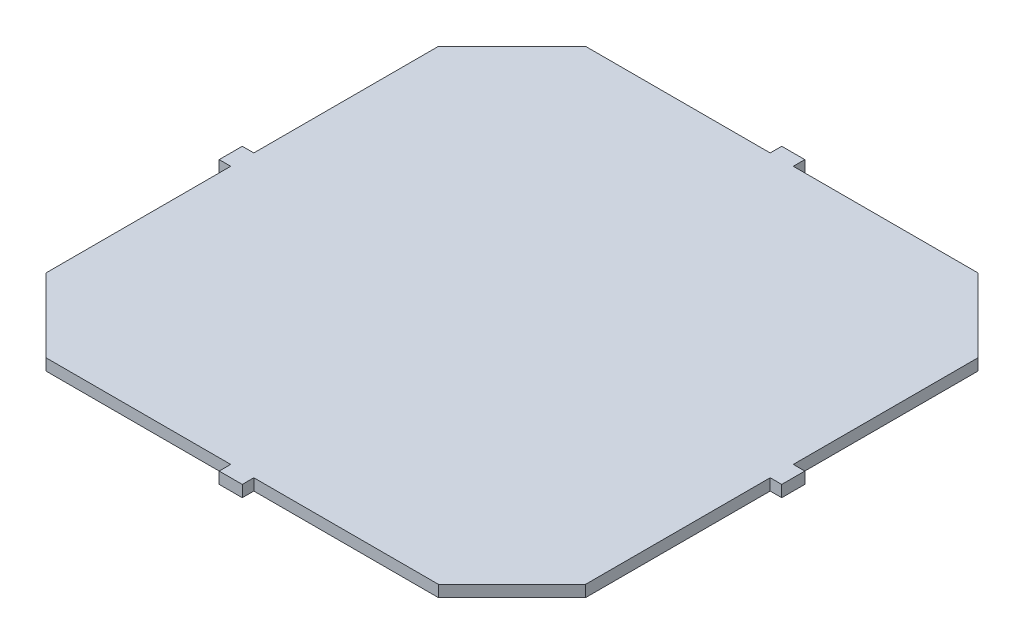
from build123d import *

# Parameters (mm, degrees)
BOSS_EXTRUDE1_DEPTH = 1
SKETCH2_W           = 1
SKETCH2_H           = 2
SKETCH2_W_2         = 2
SKETCH2_H_2         = 1
BOSS_EXTRUDE2_DEPTH = 1


with BuildPart() as part:
    # Sketch1 → Boss-Extrude1 (new body)
    with BuildSketch(Plane(origin=(0, 0, 0), x_dir=(1, 0, 0), z_dir=(0, 1, 0))):
        Polygon((-23.363961031, 17), (-17, 23.363961031), (17, 23.363961031), (23.363961031, 17), (23.363961031, -17), (17, -23.363961031), (-17, -23.363961031), (-23.363961031, -17), align=None)
    extrude(amount=BOSS_EXTRUDE1_DEPTH)

    # Sketch2 → Boss-Extrude2 (add)
    with BuildSketch(Plane(origin=(0, 1, 0), x_dir=(1, 0, 0), z_dir=(0, 1, 0))):
        with Locations((-23.863961031, 0)):
            Rectangle(SKETCH2_W, SKETCH2_H)
        with Locations((0, 23.863961031)):
            Rectangle(SKETCH2_W_2, SKETCH2_H_2)
        with Locations((0, -23.863961031)):
            Rectangle(SKETCH2_W_2, SKETCH2_H_2)
        with Locations((23.863961031, 0)):
            Rectangle(SKETCH2_W, SKETCH2_H)
    extrude(amount=-BOSS_EXTRUDE2_DEPTH)


solid = part.part
